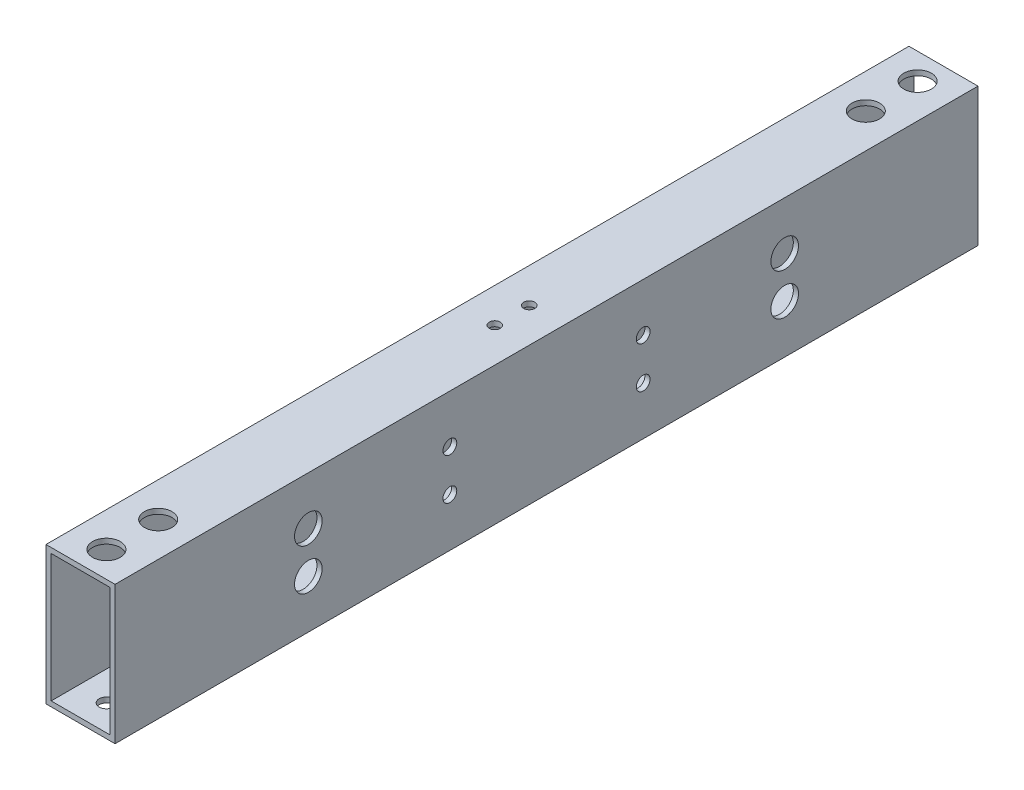
from build123d import *

# Parameters (mm, degrees)
SKETCH_1_W          = 20
SKETCH_1_H          = 40
SKETCH_1_W_2        = 17
SKETCH_1_H_2        = 37
EXTRUDE_1_DEPTH     = 250
SKETCH_2_R          = 2
CUT_EXTRUDE_1_DEPTH = 252.594912508
SKETCH_3_R          = 2.1
CUT_EXTRUDE_2_DEPTH = 254.377189186
SKETCH_4_R          = 1.6
CUT_EXTRUDE_3_DEPTH = 254.377189186
SKETCH_5_R          = 4
CUT_EXTRUDE_4_DEPTH = 10
SKETCH_6_R          = 4
CUT_EXTRUDE_5_DEPTH = 10


with BuildPart() as part:
    # 草图1 → 凸台-拉伸1 (new body)
    with BuildSketch(Plane.XY):
        Rectangle(SKETCH_1_W, SKETCH_1_H)
        Rectangle(SKETCH_1_W_2, SKETCH_1_H_2, mode=Mode.SUBTRACT)
    extrude(amount=-EXTRUDE_1_DEPTH)

    # 草图2 → 切除-拉伸1 (cut, through all)
    with BuildSketch(Plane.ZY.offset(10)):
        with Locations((-97, 6)):
            Circle(SKETCH_2_R)
        with Locations((-56, 6)):
            Circle(SKETCH_2_R)
        with Locations((-56, -6)):
            Circle(SKETCH_2_R)
        with Locations((-97, -6)):
            Circle(SKETCH_2_R)
        with Locations((-153, -6)):
            Circle(SKETCH_2_R)
        with Locations((-194, -6)):
            Circle(SKETCH_2_R)
        with Locations((-194, 6)):
            Circle(SKETCH_2_R)
        with Locations((-153, 6)):
            Circle(SKETCH_2_R)
    extrude(amount=-CUT_EXTRUDE_1_DEPTH, mode=Mode.SUBTRACT)

    # 草图3 → 切除-拉伸2 (cut, through all)
    with BuildSketch(Plane(origin=(0, 20, 0), x_dir=(1, 0, 0), z_dir=(0, 1, 0))):
        with Locations((0, 22.5)):
            Circle(SKETCH_3_R)
        with Locations((0, 7.5)):
            Circle(SKETCH_3_R)
        with Locations((0, 242.5)):
            Circle(SKETCH_3_R)
        with Locations((0, 227.5)):
            Circle(SKETCH_3_R)
    extrude(amount=-CUT_EXTRUDE_2_DEPTH, mode=Mode.SUBTRACT)

    # 草图4 → 切除-拉伸3 (cut, through all)
    with BuildSketch(Plane(origin=(0, 20, 0), x_dir=(1, 0, 0), z_dir=(0, 1, 0))):
        with Locations((0, 130)):
            Circle(SKETCH_4_R)
        with Locations((0, 120)):
            Circle(SKETCH_4_R)
    extrude(amount=-CUT_EXTRUDE_3_DEPTH, mode=Mode.SUBTRACT)

    # 草图5 → 切除-拉伸4 (cut)
    with BuildSketch(Plane(origin=(0, 20, 0), x_dir=(1, 0, 0), z_dir=(0, 1, 0))):
        with Locations((0, 22.5)):
            Circle(SKETCH_5_R)
        with Locations((0, 7.5)):
            Circle(SKETCH_5_R)
        with Locations((0, 242.5)):
            Circle(SKETCH_5_R)
        with Locations((0, 227.5)):
            Circle(SKETCH_5_R)
    extrude(amount=-CUT_EXTRUDE_4_DEPTH, mode=Mode.SUBTRACT)

    # 草图6 → 切除-拉伸5 (cut)
    with BuildSketch(Plane(origin=(10, 0, 0), x_dir=(0, 0, -1), z_dir=(1, 0, 0))):
        with Locations((56, 6)):
            Circle(SKETCH_6_R)
        with Locations((56, -6)):
            Circle(SKETCH_6_R)
        with Locations((194, 6)):
            Circle(SKETCH_6_R)
        with Locations((194, -6)):
            Circle(SKETCH_6_R)
    extrude(amount=-CUT_EXTRUDE_5_DEPTH, mode=Mode.SUBTRACT)


solid = part.part
